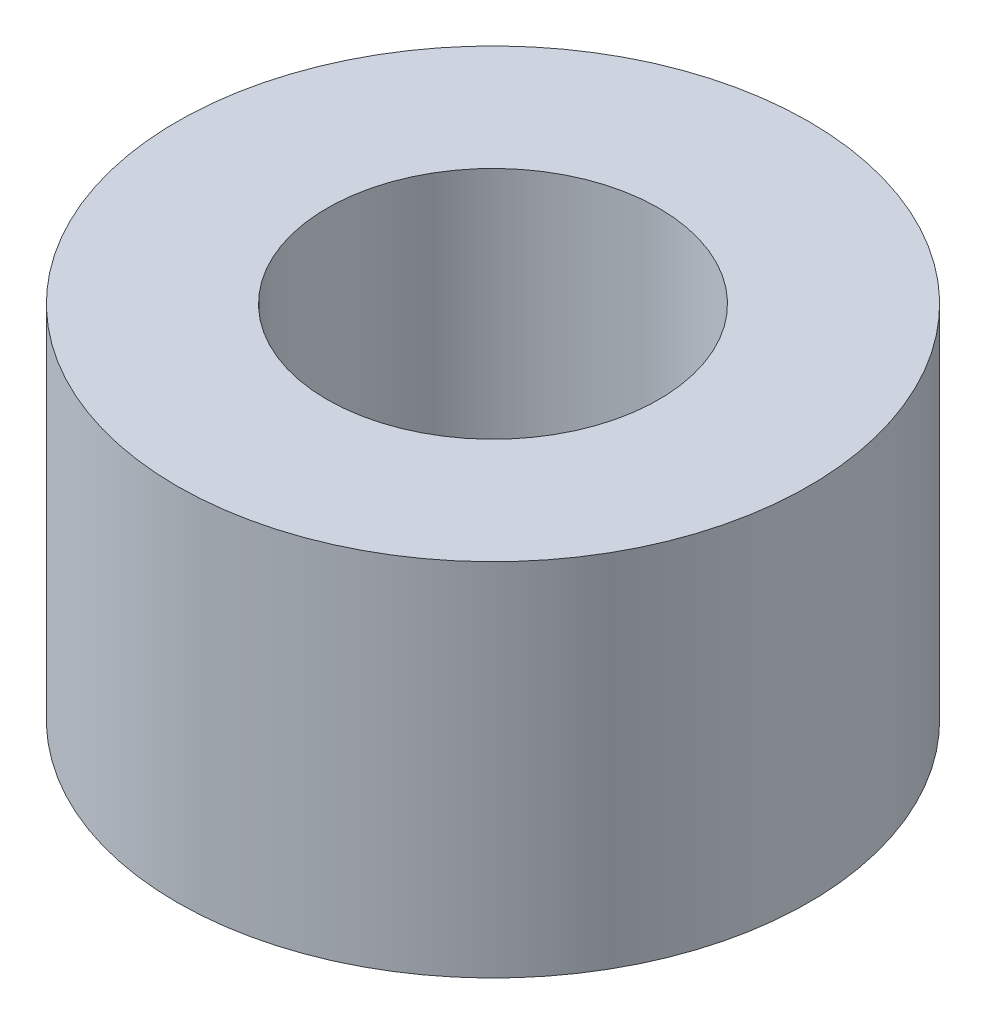
from build123d import *

# Parameters (mm, degrees)
SKETCH1_R           = 5.5626
BOSS_EXTRUDE1_DEPTH = 6.35
SKETCH2_R           = 2.921
CUT_EXTRUDE1_DEPTH  = 6.35


with BuildPart() as part:
    # Sketch1 → Boss-Extrude1 (new body)
    with BuildSketch(Plane(origin=(0, 0, 0), x_dir=(1, 0, 0), z_dir=(0, 1, 0))):
        Circle(SKETCH1_R)
    extrude(amount=BOSS_EXTRUDE1_DEPTH)

    # Sketch2 → Cut-Extrude1 (cut)
    with BuildSketch(Plane.XZ):
        Circle(SKETCH2_R)
    extrude(amount=-CUT_EXTRUDE1_DEPTH, mode=Mode.SUBTRACT)


solid = part.part
